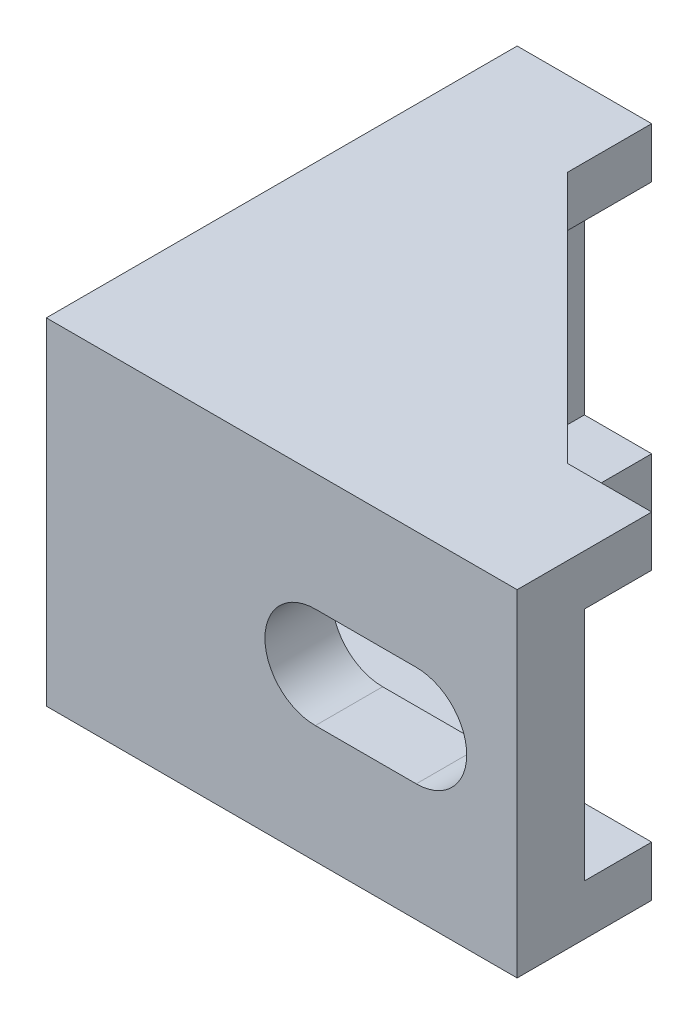
from build123d import *

# Parameters (mm, degrees)
EXTRUDE_1_DEPTH     = 20
RIB_START           = -3
RIB_1_DEPTH         = 3
CUT_EXTRUDE_1_DEPTH = 42.952353927


# Read off the part's stored shape, not the designer's step: 筋1
with BuildPart() as part:
    # 草图1 → 拉伸-薄壁1 (new body)
    with BuildSketch(Plane(origin=(0, 0, 0), x_dir=(1, 0, 0), z_dir=(0, 1, 0))):
        Polygon((0, 28), (0, 0), (28, 0), (28, 4), (4, 4), (4, 28), align=None)
    extrude(amount=-EXTRUDE_1_DEPTH)

    # 筋1 outline → 筋1 (add)
    with BuildSketch(Plane(origin=(0, 0, 0), x_dir=(1, 0, 0), z_dir=(0, 1, 0)).offset(RIB_START)):
        Polygon((8, 28), (4, 28), (4, 4), (28, 4), (28, 8), (23, 8), (8, 23), align=None)
    rib_1 = extrude(amount=RIB_1_DEPTH)

    # 镜向1: 筋1 across plane
    add(rib_1.mirror(Plane(origin=(0, -10, 0), x_dir=(0, 0, 1), z_dir=(0, -1, 0))))

    # 草图3 → 切除-拉伸1 (cut, through all)
    with BuildSketch(Plane(origin=(4, 0, 0), x_dir=(0, 0, -1), z_dir=(1, 0, 0))):
        with BuildLine():
            Line((22, -13), (16, -13))
            ThreePointArc((16, -13), (13, -10), (16, -7))
            Line((16, -7), (22, -7))
            ThreePointArc((22, -7), (25, -10), (22, -13))
        make_face()
    cut_extrude_1 = extrude(amount=-CUT_EXTRUDE_1_DEPTH, mode=Mode.SUBTRACT)

    # 镜向2: 切除-拉伸1 across plane
    add(cut_extrude_1.mirror(Plane(origin=(0, 0, 0), x_dir=(-0.7071067811865478, 0, 0.7071067811865472), z_dir=(0.7071067811865475, 0, 0.7071067811865477))), mode=Mode.SUBTRACT)


solid = part.part
